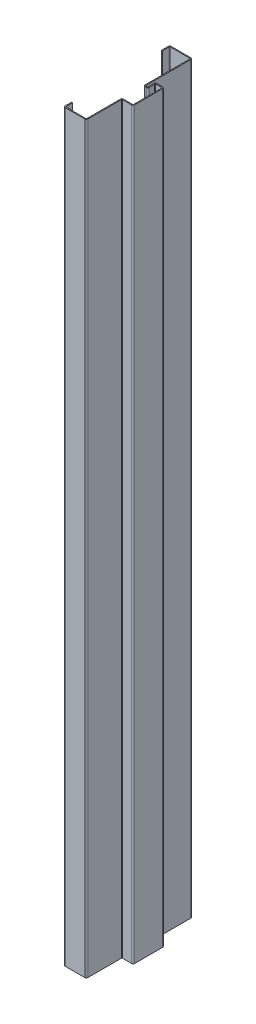
from build123d import *

# Parameters (mm, degrees)
BASE_FLANGE1_DEPTH = 490.75


# Sheet-metal steps are written as plain solids
with BuildPart() as part:
    # Sketch1 → Base-Flange1 (new, symmetric)
    with BuildSketch(Plane(origin=(0, 0, 0), x_dir=(1, 0, 0), z_dir=(0, 1, 0))):
        with BuildLine():
            Line((9.5, 59.25), (9.5, 68.0134))
            ThreePointArc((9.5, 68.0134), (10.081861668, 69.418138332), (11.4866, 70))
            Line((11.4866, 70), (37.5134, 70))
            ThreePointArc((37.5134, 70), (38.918138332, 69.418138332), (39.5, 68.0134))
            Line((39.5, 68.0134), (39.5, 23))
            Line((39.5, 23), (39.5, 8.562771629))
            ThreePointArc((39.5, 8.562771629), (39.724914644, 8.032905932), (40.262306969, 7.826620346))
            Line((40.262306969, 7.826620346), (42.153527557, 7.892663224))
            ThreePointArc((42.153527557, 7.892663224), (42.675221066, 8.135932903), (42.862626267, 8.680197126))
            Line((42.862626267, 8.680197126), (42.359529101, 15.874821789))
            ThreePointArc((42.359529101, 15.874821789), (42.88838258, 17.368257942), (44.341289843, 18))
            Line((44.341289843, 18), (52.2634, 18))
            ThreePointArc((52.2634, 18), (53.668138332, 17.418138332), (54.25, 16.0134))
            Line((54.25, 16.0134), (54.25, -21.0134))
            ThreePointArc((54.25, -21.0134), (53.668138332, -22.418138332), (52.2634, -23))
            Line((52.2634, -23), (40.2366, -23))
            ThreePointArc((40.2366, -23), (39.715745145, -23.215745145), (39.5, -23.7366))
            Line((39.5, -23.7366), (39.5, -68.0134))
            ThreePointArc((39.5, -68.0134), (38.918138332, -69.418138332), (37.5134, -70))
            Line((37.5134, -70), (11.4866, -70))
            ThreePointArc((11.4866, -70), (10.081861668, -69.418138332), (9.5, -68.0134))
            Line((9.5, -68.0134), (9.5, -59.25))
            Line((9.5, -59.25), (10.75, -59.25))
            Line((10.75, -59.25), (10.75, -68.0134))
            ThreePointArc((10.75, -68.0134), (10.965745145, -68.534254855), (11.4866, -68.75))
            Line((11.4866, -68.75), (37.5134, -68.75))
            ThreePointArc((37.5134, -68.75), (38.034254855, -68.534254855), (38.25, -68.0134))
            Line((38.25, -68.0134), (38.25, -23.7366))
            ThreePointArc((38.25, -23.7366), (38.831861668, -22.331861668), (40.2366, -21.75))
            Line((40.2366, -21.75), (52.2634, -21.75))
            ThreePointArc((52.2634, -21.75), (52.784254855, -21.534254855), (53, -21.0134))
            Line((53, -21.0134), (53, 16.0134))
            ThreePointArc((53, 16.0134), (52.784254855, 16.534254855), (52.2634, 16.75))
            Line((52.2634, 16.75), (44.341289843, 16.75))
            ThreePointArc((44.341289843, 16.75), (43.802574707, 16.515759992), (43.606484164, 15.962017381))
            Line((43.606484164, 15.962017381), (44.10958133, 8.767392718))
            ThreePointArc((44.10958133, 8.767392718), (43.604152098, 7.299519645), (42.197151928, 6.64342469))
            Line((42.197151928, 6.64342469), (40.30593134, 6.577381812))
            ThreePointArc((40.30593134, 6.577381812), (38.856591681, 7.133731182), (38.25, 8.562771629))
            Line((38.25, 8.562771629), (38.25, 23))
            Line((38.25, 23), (38.25, 68.0134))
            ThreePointArc((38.25, 68.0134), (38.034254855, 68.534254855), (37.5134, 68.75))
            Line((37.5134, 68.75), (11.4866, 68.75))
            ThreePointArc((11.4866, 68.75), (10.965745145, 68.534254855), (10.75, 68.0134))
            Line((10.75, 68.0134), (10.75, 59.25))
            Line((10.75, 59.25), (9.5, 59.25))
        make_face()
    extrude(amount=BASE_FLANGE1_DEPTH, both=True)


solid = part.part
